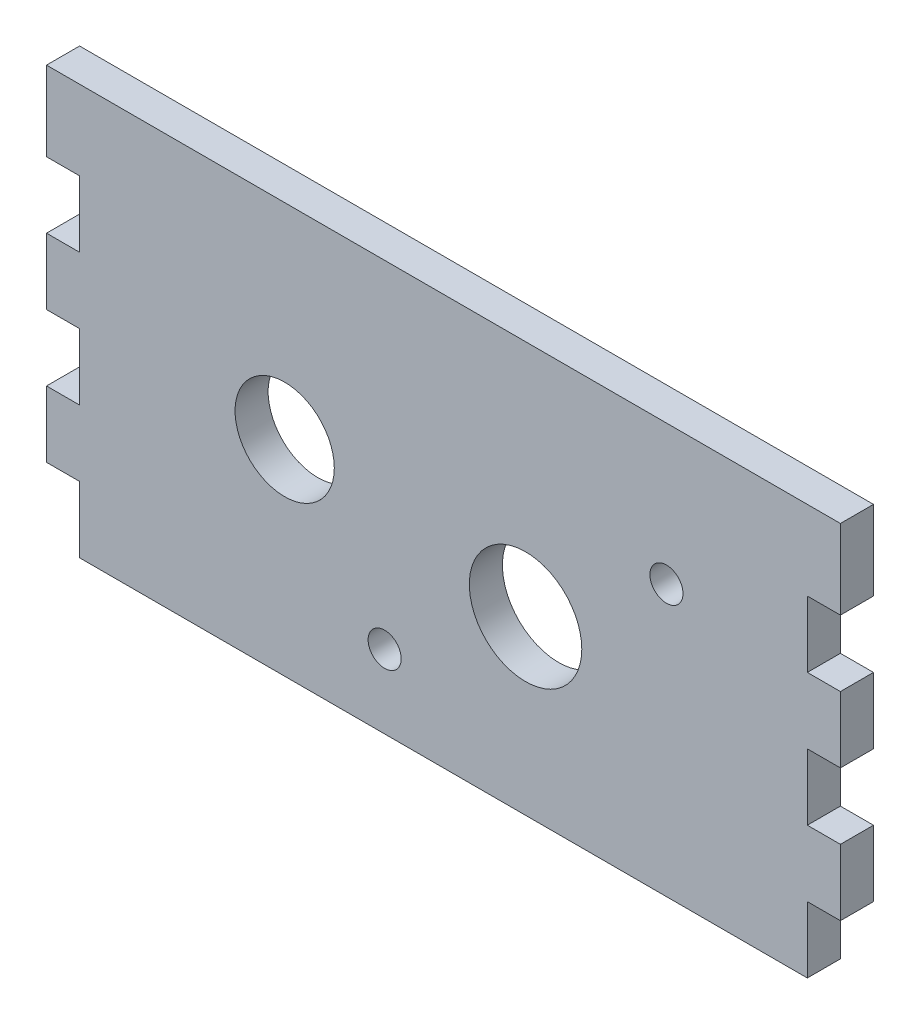
from build123d import *

# Parameters (mm, degrees)
SKETCH_2_W               = 120
SKETCH_2_H               = 62
SKETCH_2_R               = 2.5
SKETCH_2_R_2             = 8.5
SKETCH_2_R_3             = 7.5
EXTRUDE_1_DEPTH          = 5
CUT_EXTRUDE_1_REACH      = 69.72
SKETCH_3_W               = 5
SKETCH_3_H               = 10
PATTERN_LINEAR_1_COUNT   = 3
PATTERN_LINEAR_1_PITCH   = 20
MIRROR_1_COPY_1_REACH    = 69.72
MIRROR_1_COPY_1_SKETCH_W = 5
MIRROR_1_COPY_1_SKETCH_H = 10
MIRROR_1_COPY_2_REACH    = 69.72
MIRROR_1_COPY_2_SKETCH_W = 5
MIRROR_1_COPY_2_SKETCH_H = 10
MIRROR_1_COPY_3_REACH    = 69.72
MIRROR_1_COPY_3_SKETCH_W = 5
MIRROR_1_COPY_3_SKETCH_H = 10


with BuildPart() as part:
    # 스케치2 → 보스-돌출1 (new body)
    with BuildSketch(Plane.XY):
        Rectangle(SKETCH_2_W, SKETCH_2_H)
        with Locations((-8.889677969, -19.912987345)):
            Circle(SKETCH_2_R, mode=Mode.SUBTRACT)
        with Locations((12.408275183, -5)):
            Circle(SKETCH_2_R_2, mode=Mode.SUBTRACT)
        with Locations((-24, 0)):
            Circle(SKETCH_2_R_3, mode=Mode.SUBTRACT)
        with Locations((33.706228335, 9.912987345)):
            Circle(SKETCH_2_R, mode=Mode.SUBTRACT)
    extrude(amount=EXTRUDE_1_DEPTH)

    # 스케치3 → 컷-돌출1 (cut, up to next)
    with BuildSketch(Plane.XY.offset(5), mode=Mode.PRIVATE) as cut_extrude_1_sk1:
        with Locations((-57.5, -26)):
            Rectangle(SKETCH_3_W, SKETCH_3_H)
    cut_extrude_1_tool1 = extrude(cut_extrude_1_sk1.sketch, amount=-CUT_EXTRUDE_1_REACH, mode=Mode.PRIVATE) & part.part
    cut_extrude_1 = cut_extrude_1_tool1.solids().sort_by_distance((-57.5, -26, 5))[0]
    add(cut_extrude_1, mode=Mode.SUBTRACT)

    # 선형 패턴1: 컷-돌출1 ×3
    with Locations(*[(0, i * PATTERN_LINEAR_1_PITCH, 0) for i in range(1, PATTERN_LINEAR_1_COUNT)]):
        add(cut_extrude_1, mode=Mode.SUBTRACT)

    # 대칭 복사1 copy 1 sketch → 대칭 복사1 copy 1 (cut, up to next)
    with BuildSketch(Plane(origin=(0, 20, 5), x_dir=(-1, 0, 0), z_dir=(0, 0, 1)), mode=Mode.PRIVATE) as mirror_1_copy_1_sk1:
        with Locations((-57.5, 26)):
            Rectangle(MIRROR_1_COPY_1_SKETCH_W, MIRROR_1_COPY_1_SKETCH_H)
    mirror_1_copy_1_tool1 = extrude(mirror_1_copy_1_sk1.sketch, amount=-MIRROR_1_COPY_1_REACH, mode=Mode.PRIVATE) & part.part
    add(mirror_1_copy_1_tool1.solids().sort_by_distance((57.5, -6, 5))[0], mode=Mode.SUBTRACT)

    # 대칭 복사1 copy 2 sketch → 대칭 복사1 copy 2 (cut, up to next)
    with BuildSketch(Plane(origin=(0, 40, 5), x_dir=(-1, 0, 0), z_dir=(0, 0, 1)), mode=Mode.PRIVATE) as mirror_1_copy_2_sk1:
        with Locations((-57.5, 26)):
            Rectangle(MIRROR_1_COPY_2_SKETCH_W, MIRROR_1_COPY_2_SKETCH_H)
    mirror_1_copy_2_tool1 = extrude(mirror_1_copy_2_sk1.sketch, amount=-MIRROR_1_COPY_2_REACH, mode=Mode.PRIVATE) & part.part
    add(mirror_1_copy_2_tool1.solids().sort_by_distance((57.5, 14, 5))[0], mode=Mode.SUBTRACT)

    # 대칭 복사1 copy 3 sketch → 대칭 복사1 copy 3 (cut, up to next)
    with BuildSketch(Plane(origin=(0, 0, 5), x_dir=(-1, 0, 0), z_dir=(0, 0, 1)), mode=Mode.PRIVATE) as mirror_1_copy_3_sk1:
        with Locations((-57.5, 26)):
            Rectangle(MIRROR_1_COPY_3_SKETCH_W, MIRROR_1_COPY_3_SKETCH_H)
    mirror_1_copy_3_tool1 = extrude(mirror_1_copy_3_sk1.sketch, amount=-MIRROR_1_COPY_3_REACH, mode=Mode.PRIVATE) & part.part
    add(mirror_1_copy_3_tool1.solids().sort_by_distance((57.5, -26, 5))[0], mode=Mode.SUBTRACT)


solid = part.part
